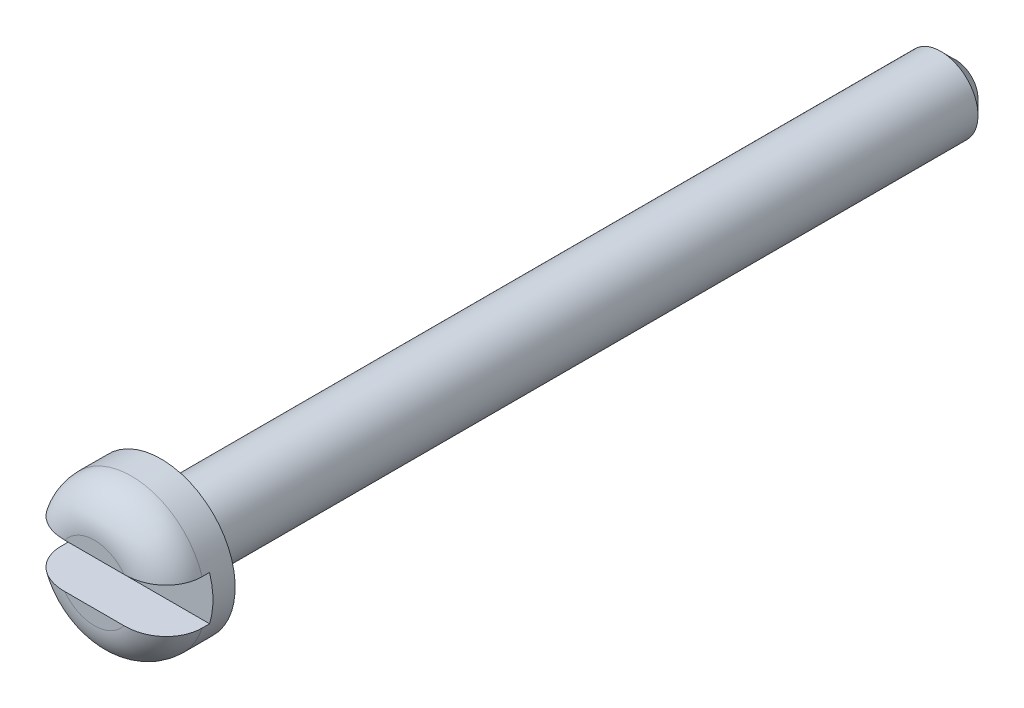
from build123d import *

# Parameters (mm, degrees)
CUT_EXTRUDE_1_DEPTH      = 24.421411145
CUT_EXTRUDE_1_DEPTH_BACK = 24.421411145
SKETCH_2_W               = 1.2
SKETCH_2_H               = 1.2
CHAMFER_1_SIZE           = 0.4
FILLET_1_R               = 1
FILLET_2_R               = 0.4


with BuildPart() as part:
    # Эскиз1 → Повернуть1 (revolve)
    with BuildSketch(Plane(origin=(0, 0, 0), x_dir=(1, 0, 0), z_dir=(0, 1, 0))):
        Polygon((0, 0), (-2, 0), (-2, 1.8), (-1, 1.8), (-1, 23.25), (0, 23.25), align=None)
    revolve(axis=Axis((0, 0, -23.25), (0, 0, 1)))

    # Эскиз2 → Вырез-Вытянуть1 (cut, two sides: drawn at the far end of the back side and taken through both)
    with BuildSketch(Plane(origin=(0, 0, 0), x_dir=(0, 0, -1), z_dir=(1, 0, 0)).offset(-CUT_EXTRUDE_1_DEPTH_BACK)):
        with Locations((0.6, 0)):
            Rectangle(SKETCH_2_W, SKETCH_2_H)
    extrude(amount=CUT_EXTRUDE_1_DEPTH + CUT_EXTRUDE_1_DEPTH_BACK, mode=Mode.SUBTRACT)

    # Фаска1
    chamfer_1_edges = [part.edges().sort_by_distance(p)[0] for p in [
        (1, 0, -23.25),
    ]]
    chamfer(chamfer_1_edges, length=CHAMFER_1_SIZE)

    # Скругление1
    fillet_1_edges = [part.edges().sort_by_distance(p)[0] for p in [
        (0, -2, 0),
        (0, 2, 0),
    ]]
    fillet(fillet_1_edges, radius=FILLET_1_R)

    # Скругление2
    fillet_2_edges = [part.edges().sort_by_distance(p)[0] for p in [
        (1, 0, -1.8),
    ]]
    fillet(fillet_2_edges, radius=FILLET_2_R)


solid = part.part
